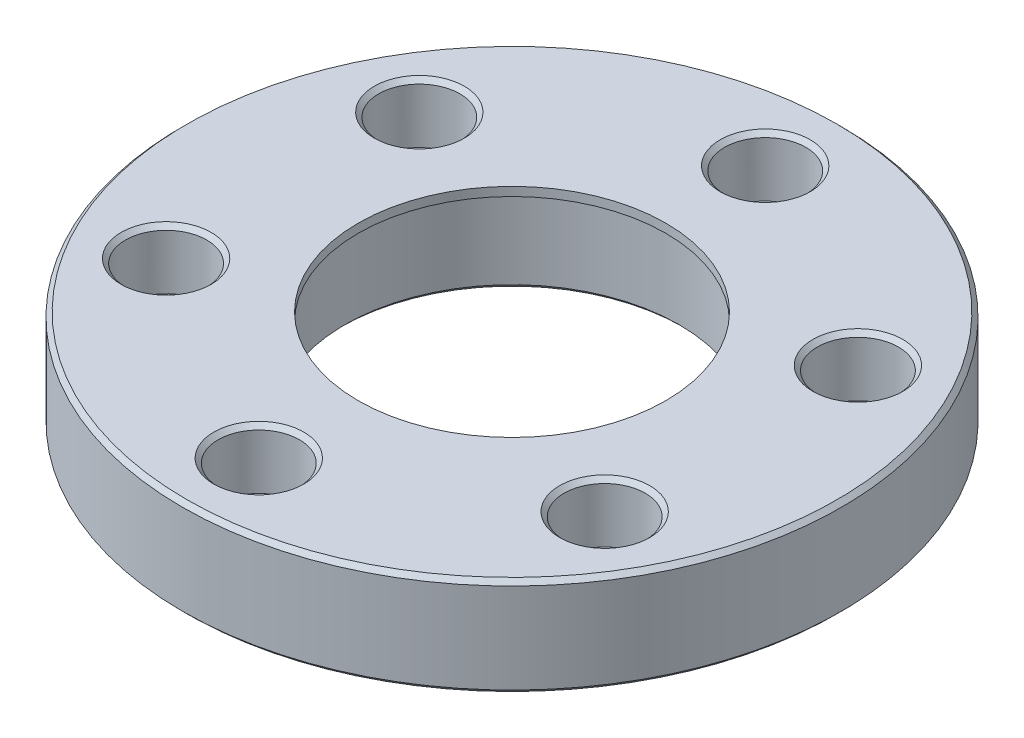
from build123d import *

# Parameters (mm, degrees)
SKETCH_1_R          = 15
SKETCH_1_R_2        = 7
SKETCH_1_R_3        = 1.85
EXTRUDE_1_DEPTH     = 2.7
EXTRUDE_START       = 1.8
SKETCH_2_R          = 15
SKETCH_2_R_2        = 7
SKETCH_2_R_3        = 0.9
EXTRUDE_2_DEPTH     = 1.8
SKETCH_3_R          = 7.6
CUT_EXTRUDE_1_DEPTH = 4.1
CHAMFER_1_SIZE      = 0.2
CHAMFER_2_SIZE      = 0.3


with BuildPart() as part:
    # 草图1 → 凸台-拉伸1 (new body)
    with BuildSketch(Plane(origin=(0, 0, 0), x_dir=(1, 0, 0), z_dir=(0, 1, 0))):
        Circle(SKETCH_1_R)
        Circle(SKETCH_1_R_2, mode=Mode.SUBTRACT)
        with Locations((0, 11.525)):
            Circle(SKETCH_1_R_3, mode=Mode.SUBTRACT)
        with Locations((9.980942779, 5.7625)):
            Circle(SKETCH_1_R_3, mode=Mode.SUBTRACT)
        with Locations((9.980942779, -5.7625)):
            Circle(SKETCH_1_R_3, mode=Mode.SUBTRACT)
        with Locations((0, -11.525)):
            Circle(SKETCH_1_R_3, mode=Mode.SUBTRACT)
        with Locations((-9.980942779, -5.7625)):
            Circle(SKETCH_1_R_3, mode=Mode.SUBTRACT)
        with Locations((-9.980942779, 5.7625)):
            Circle(SKETCH_1_R_3, mode=Mode.SUBTRACT)
    extrude(amount=EXTRUDE_1_DEPTH)

    # 草图2 → 凸台-拉伸2 (add)
    with BuildSketch(Plane(origin=(0, 0, 0), x_dir=(-1, 0, 0), z_dir=(0, -1, 0)).offset(EXTRUDE_START)):
        Circle(SKETCH_2_R)
        Circle(SKETCH_2_R_2, mode=Mode.SUBTRACT)
        with Locations((0, 11.53)):
            Circle(SKETCH_2_R_3, mode=Mode.SUBTRACT)
        with Locations((9.985272906, 5.765)):
            Circle(SKETCH_2_R_3, mode=Mode.SUBTRACT)
        with Locations((9.985272906, -5.765)):
            Circle(SKETCH_2_R_3, mode=Mode.SUBTRACT)
        with Locations((0, -11.53)):
            Circle(SKETCH_2_R_3, mode=Mode.SUBTRACT)
        with Locations((-9.985272906, -5.765)):
            Circle(SKETCH_2_R_3, mode=Mode.SUBTRACT)
        with Locations((-9.985272906, 5.765)):
            Circle(SKETCH_2_R_3, mode=Mode.SUBTRACT)
    extrude(amount=-EXTRUDE_2_DEPTH)

    # 草图3 → 切除-拉伸1 (cut)
    with BuildSketch(Plane(origin=(0, -1.8, 0), x_dir=(-1, 0, 0), z_dir=(0, -1, 0))):
        Circle(SKETCH_3_R)
    extrude(amount=-CUT_EXTRUDE_1_DEPTH, mode=Mode.SUBTRACT)

    # 倒角1
    chamfer_1_edges = [part.edges().sort_by_distance(p)[0] for p in [
        (15, -1.8, 0),
        (-11.830942779, 2.7, -5.7625),
        (-1.85, 2.7, 11.525),
        (8.130942779, 2.7, -5.7625),
        (-15, 2.7, 0),
        (-1.85, 2.7, -11.525),
        (8.130942779, 2.7, 5.7625),
        (-11.830942779, 2.7, 5.7625),
        (10.885272906, -1.8, -5.765),
        (0.9, -1.8, 11.53),
        (-9.085272906, -1.8, -5.765),
        (0.9, -1.8, -11.53),
        (-9.085272906, -1.8, 5.765),
        (10.885272906, -1.8, 5.765),
        (7.6, -1.8, 0),
    ]]
    chamfer(chamfer_1_edges, length=CHAMFER_1_SIZE)

    # 倒角2
    chamfer_2_edges = [part.edges().sort_by_distance(p)[0] for p in [
        (7.6, 2.3, 0),
    ]]
    chamfer(chamfer_2_edges, length=CHAMFER_2_SIZE)


solid = part.part
